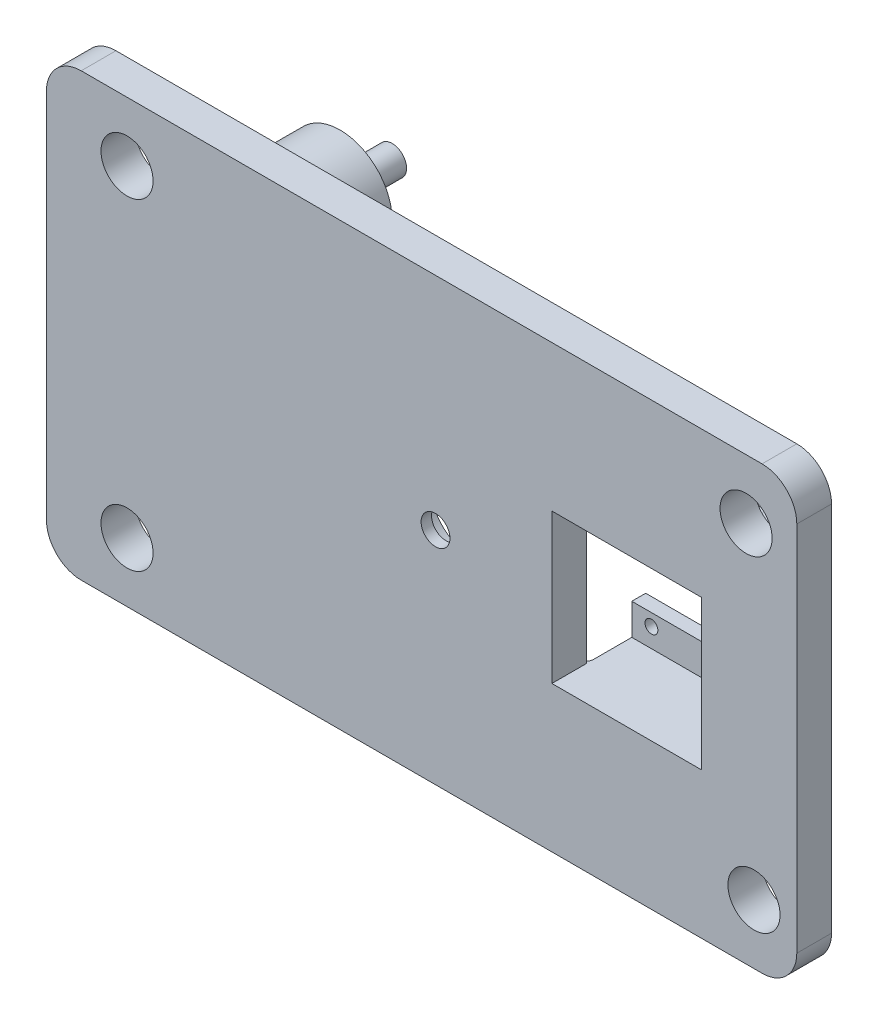
from build123d import *

# Parameters (mm, degrees)
SKETCH1_W            = 216
SKETCH1_H            = 127
BOSS_EXTRUDE1_DEPTH  = 10
FILLET1_R            = 10
FILLET2_R            = 10
SKETCH9_R            = 11.35
CUT_EXTRUDE4_DEPTH   = 7
SKETCH12_R           = 4.15
CUT_EXTRUDE5_DEPTH   = 7
SKETCH9_4_W          = 43
SKETCH9_4_H          = 43
CUT_EXTRUDE6_DEPTH   = 126.683133315
SKETCH13_W           = 43
SKETCH13_H           = 4
BOSS_EXTRUDE2_DEPTH  = 17
FILLET4_R            = 2
SKETCH17_W           = 43
SKETCH17_H           = 4
BOSS_EXTRUDE5_DEPTH  = 9
SKETCH18_W           = 43
SKETCH18_H           = 4
BOSS_EXTRUDE6_DEPTH  = 17
SKETCH19_W           = 43
SKETCH19_H           = 4
BOSS_EXTRUDE7_DEPTH  = 9
FILLET5_R            = 2
SKETCH20_R           = 1.85
CUT_EXTRUDE7_DEPTH   = 9
SKETCH23_R           = 1.85
CUT_EXTRUDE8_DEPTH   = 9
SKETCH25_R           = 15
BOSS_EXTRUDE9_DEPTH  = 17.5
SKETCH26_R           = 4.15
BOSS_EXTRUDE10_DEPTH = 15
SKETCH27_R           = 4.15
BOSS_EXTRUDE11_DEPTH = 15
FILLET9_R            = 2
FILLET10_R           = 2
SKETCH28_R           = 7.5
CUT_EXTRUDE9_DEPTH   = 133.297014328


with BuildPart() as part:
    # Sketch1 → Boss-Extrude1 (new body)
    with BuildSketch(Plane.XY):
        Rectangle(SKETCH1_W, SKETCH1_H)
    extrude(amount=BOSS_EXTRUDE1_DEPTH)

    # Fillet1
    fillet1_edges = [part.edges().sort_by_distance(p)[0] for p in [
        (-108, 63.5, 5),
    ]]
    fillet(fillet1_edges, radius=FILLET1_R)

    # Fillet2
    fillet2_edges = [part.edges().sort_by_distance(p)[0] for p in [
        (-108, -63.5, 5),
        (108, 63.5, 5),
        (108, -63.5, 5),
    ]]
    fillet(fillet2_edges, radius=FILLET2_R)

    # Sketch9 → Cut-Extrude4 (cut)
    with BuildSketch(Plane(origin=(0, 0, 0), x_dir=(-1, 0, 0), z_dir=(0, 0, -1))):
        with Locations((-4, 0)):
            Circle(SKETCH9_R)
    extrude(amount=-CUT_EXTRUDE4_DEPTH, mode=Mode.SUBTRACT)

    # Sketch12 → Cut-Extrude5 (cut)
    with BuildSketch(Plane(origin=(0, 0, 7), x_dir=(-1, 0, 0), z_dir=(0, 0, -1))):
        with Locations((-4, 0)):
            Circle(SKETCH12_R)
    extrude(amount=-CUT_EXTRUDE5_DEPTH, mode=Mode.SUBTRACT)

    # Sketch9<4> → Cut-Extrude6 (cut, through all)
    with BuildSketch(Plane(origin=(0, 0, 0), x_dir=(-1, 0, 0), z_dir=(0, 0, -1))):
        with Locations((-59, 0)):
            Rectangle(SKETCH9_4_W, SKETCH9_4_H)
    extrude(amount=-CUT_EXTRUDE6_DEPTH, mode=Mode.SUBTRACT)

    # Sketch13 → Boss-Extrude2 (add)
    with BuildSketch(Plane(origin=(0, 0, 0), x_dir=(-1, 0, 0), z_dir=(0, 0, -1))):
        with Locations((-59, -23.5)):
            Rectangle(SKETCH13_W, SKETCH13_H)
    extrude(amount=BOSS_EXTRUDE2_DEPTH)

    # Fillet4
    fillet4_edges = [part.edges().sort_by_distance(p)[0] for p in [
        (59, -25.5, 0),
        (37.5, -23.5, 0),
        (80.5, -23.5, 0),
    ]]
    fillet(fillet4_edges, radius=FILLET4_R)

    # Sketch17 → Boss-Extrude5 (add)
    with BuildSketch(Plane(origin=(0, -21.5, 0), x_dir=(1, 0, 0), z_dir=(0, 1, 0))):
        with Locations((59, 15)):
            Rectangle(SKETCH17_W, SKETCH17_H)
    extrude(amount=BOSS_EXTRUDE5_DEPTH)

    # Sketch18 → Boss-Extrude6 (add)
    with BuildSketch(Plane(origin=(0, 0, 0), x_dir=(-1, 0, 0), z_dir=(0, 0, -1))):
        with Locations((-59, 23.5)):
            Rectangle(SKETCH18_W, SKETCH18_H)
    extrude(amount=BOSS_EXTRUDE6_DEPTH)

    # Sketch19 → Boss-Extrude7 (add)
    with BuildSketch(Plane(origin=(0, 21.5, 0), x_dir=(-1, 0, 0), z_dir=(0, -1, 0))):
        with Locations((-59, 15)):
            Rectangle(SKETCH19_W, SKETCH19_H)
    extrude(amount=BOSS_EXTRUDE7_DEPTH)

    # Fillet5
    fillet5_edges = [part.edges().sort_by_distance(p)[0] for p in [
        (37.5, 23.5, 0),
        (80.5, 23.5, 0),
        (59, 25.5, 0),
    ]]
    fillet(fillet5_edges, radius=FILLET5_R)

    # Sketch20 → Cut-Extrude7 (cut)
    with BuildSketch(Plane(origin=(0, 0, -17), x_dir=(-1, 0, 0), z_dir=(0, 0, -1))):
        with Locations((-43.15, -16)):
            Circle(SKETCH20_R)
        with Locations((-74.85, -16)):
            Circle(SKETCH20_R)
    extrude(amount=-CUT_EXTRUDE7_DEPTH, mode=Mode.SUBTRACT)

    # Sketch23 → Cut-Extrude8 (cut)
    with BuildSketch(Plane(origin=(0, 0, -17), x_dir=(-1, 0, 0), z_dir=(0, 0, -1))):
        with Locations((-43.15, 15.85)):
            Circle(SKETCH23_R)
        with Locations((-74.85, 16)):
            Circle(SKETCH23_R)
    extrude(amount=-CUT_EXTRUDE8_DEPTH, mode=Mode.SUBTRACT)

    # Sketch25 → Boss-Extrude9 (add)
    with BuildSketch(Plane(origin=(0, 0, 0), x_dir=(-1, 0, 0), z_dir=(0, 0, -1))):
        with Locations((50.981638517, -43.5)):
            Circle(SKETCH25_R)
        with Locations((50.981638517, 43.5)):
            Circle(SKETCH25_R)
    extrude(amount=BOSS_EXTRUDE9_DEPTH)

    # Sketch26 → Boss-Extrude10 (add)
    with BuildSketch(Plane(origin=(0, 0, -17.5), x_dir=(-1, 0, 0), z_dir=(0, 0, -1))):
        with Locations((50.981638517, -43.5)):
            Circle(SKETCH26_R)
    extrude(amount=BOSS_EXTRUDE10_DEPTH)

    # Sketch27 → Boss-Extrude11 (add)
    with BuildSketch(Plane(origin=(0, 0, -17.5), x_dir=(-1, 0, 0), z_dir=(0, 0, -1))):
        with Locations((50.981638517, 43.5)):
            Circle(SKETCH27_R)
    extrude(amount=BOSS_EXTRUDE11_DEPTH)

    # Fillet9
    fillet9_edges = [part.edges().sort_by_distance(p)[0] for p in [
        (-35.981638517, -43.5, 0),
    ]]
    fillet(fillet9_edges, radius=FILLET9_R)

    # Fillet10
    fillet10_edges = [part.edges().sort_by_distance(p)[0] for p in [
        (-35.981638517, 43.5, 0),
    ]]
    fillet(fillet10_edges, radius=FILLET10_R)

    # Sketch28 → Cut-Extrude9 (cut, through all)
    with BuildSketch(Plane.XY.offset(10)):
        with Locations((-84.811667967, 46.37)):
            Circle(SKETCH28_R)
        with Locations((-84.811667967, -46.37)):
            Circle(SKETCH28_R)
        with Locations((95.674047271, -46.369786546)):
            Circle(SKETCH28_R)
        with Locations((93.399057455, 46.37)):
            Circle(SKETCH28_R)
    extrude(amount=-CUT_EXTRUDE9_DEPTH, mode=Mode.SUBTRACT)


solid = part.part
